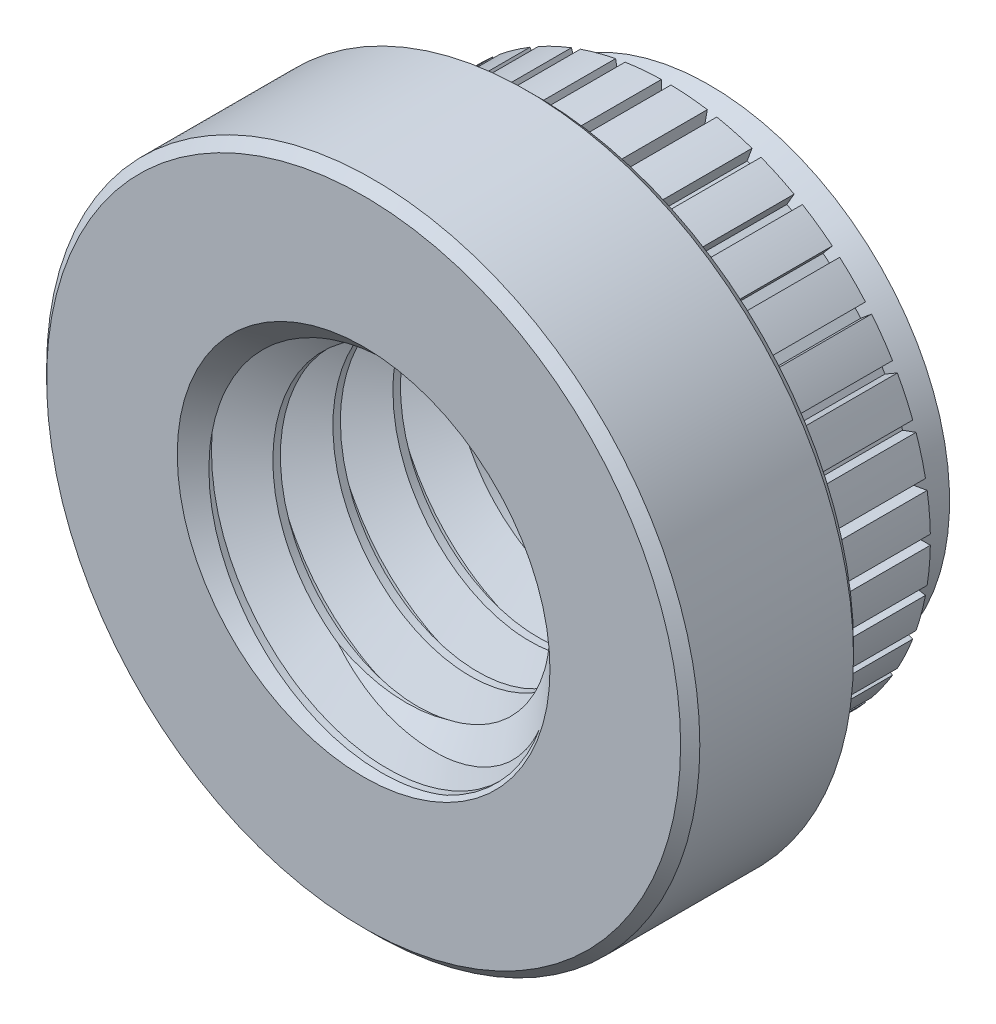
from build123d import *

# Parameters (mm, degrees)
SKETCH1_R               = 4.318
EXTRUDE1_DEPTH          = 2.286
SKETCH2_R               = 3.4925
EXTRUDE2_DEPTH          = 2.286
SKETCH3_W               = 0.127
SKETCH3_H               = 1.016
CUT_EXTRUDE_THIN1_DEPTH = 2.286
CIRPATTERN1_COUNT       = 36
SKETCH5_OUTSIDE_W       = 13.66
SKETCH5_OUTSIDE_H       = 13.66
SKETCH5_OUTSIDE_R       = 3.175
CUT_EXTRUDE1_DEPTH      = 0.5715
CUT_EXTRUDE1_DRAFT      = 20
CHAMFER2_SIZE           = 0.127
SKETCH7_R               = 2.413
CUT_EXTRUDE3_DEPTH      = 8.628461968
SWEEP1_PITCH            = 0.79375
SKETCH10_R              = 4.318
CUT_EXTRUDE4_DEPTH      = 9.064020391
SKETCH11_R              = 3.175
CUT_EXTRUDE5_DEPTH      = 8.628462028


with BuildPart() as part:
    # Sketch1 → Extrude1 (new body)
    with BuildSketch(Plane.XY):
        Circle(SKETCH1_R)
    extrude(amount=-EXTRUDE1_DEPTH)

    # Sketch2 → Extrude2 (add)
    with BuildSketch(Plane(origin=(0, 0, -2.286), x_dir=(-1, 0, 0), z_dir=(0, 0, -1))):
        with Locations(Location((0, 0, 0), (0, 0, 180))):
            Circle(SKETCH2_R)
    extrude(amount=EXTRUDE2_DEPTH)

    # Sketch3 → Cut-Extrude-Thin1 (cut)
    with BuildSketch(Plane(origin=(0, 0, -4.572), x_dir=(-1, 0, 0), z_dir=(0, 0, -1))):
        with Locations((0, 3.81)):
            Rectangle(SKETCH3_W, SKETCH3_H)
    cut_extrude_thin1 = extrude(amount=-CUT_EXTRUDE_THIN1_DEPTH, mode=Mode.SUBTRACT)

    # CirPattern1: Cut-Extrude-Thin1 ×36 about axis
    cirpattern1_axis = Axis((0, 0, 0), (0, 0, 1))
    for i in range(1, CIRPATTERN1_COUNT):
        add(cut_extrude_thin1.rotate(cirpattern1_axis, i * 360 / CIRPATTERN1_COUNT), mode=Mode.SUBTRACT)


with BuildPart() as cut_extrude1_tool:
    # Sketch5 outside → Cut-Extrude1 (with draft: the straight prism first)
    with BuildSketch(Plane(origin=(0, 0, -4.572), x_dir=(-1, 0, 0), z_dir=(0, 0, -1))):
        Rectangle(SKETCH5_OUTSIDE_W, SKETCH5_OUTSIDE_H)
        Circle(SKETCH5_OUTSIDE_R, mode=Mode.SUBTRACT)
    extrude(amount=-CUT_EXTRUDE1_DEPTH)
    # Cut-Extrude1: the draft: its side faces are tilted about the plane it starts from
    cut_extrude1_sides = [cut_extrude1_tool.faces().sort_by_distance(p)[0] for p in [
        (0, -6.83, -4.28625),
        (-6.83, 0, -4.28625),
        (0, 6.83, -4.28625),
        (6.83, 0, -4.28625),
        (3.175, 0, -4.28625),
    ]]
    draft(cut_extrude1_sides, Plane(origin=(0, 0, -4.572), x_dir=(-1, 0, 0), z_dir=(0, 0, -1)), CUT_EXTRUDE1_DRAFT)


with BuildPart() as part_1:
    add(part.part)

    # Cut-Extrude1: cut by cut_extrude1_tool
    add(cut_extrude1_tool.part, mode=Mode.SUBTRACT)

    # Chamfer2
    chamfer2_edges = [part_1.edges().sort_by_distance(p)[0] for p in [
        (-4.318, 0, 0),
        (-4.318, 0, -2.286),
    ]]
    chamfer(chamfer2_edges, length=CHAMFER2_SIZE)

    # Sketch7 → Cut-Extrude3 (cut, through all)
    with BuildSketch(Plane.XY):
        Circle(SKETCH7_R)
    extrude(amount=-CUT_EXTRUDE3_DEPTH, mode=Mode.SUBTRACT)

    # Sweep1: the profile of Sketch9 profile screwed along a right-hand helix of 9.76 turns, 6 arcs to a turn; built about Z, then put on its axis
    sweep1_z = Axis((0, 0, 0), (0, 0, 1))
    sweep1_corners = [(2.4133, 0, -0.694704455), (1.897444252, 0, -0.396875), (1.897444252, 0, -0.29765625), (2.4133, 0, 0.000173205)]
    with BuildLine(mode=Mode.PRIVATE) as sweep1_profile:
        Line(sweep1_corners[0], sweep1_corners[1])
        Line(sweep1_corners[1], sweep1_corners[2])
        Line(sweep1_corners[2], sweep1_corners[3])
        Line(sweep1_corners[3], sweep1_corners[0])
    sweep1_cap = Face(sweep1_profile.wire())
    sweep1_turn_angles = [0, 30, 60, 90, 120, 150, 180, 210, 240, 270, 300, 330, 360]
    sweep1_turn_weights = [1, 0.8660254037844387, 1, 0.8660254037844387, 1, 0.8660254037844387, 1, 0.8660254037844387, 1, 0.8660254037844387, 1, 0.8660254037844387, 1]
    sweep1_turn_rails = [Edge.make_bspline([Vector(p[0], p[1], 0).rotate(sweep1_z, sweep1_turn_angles[k]) / sweep1_turn_weights[k] + Vector(0, 0, p[2] + SWEEP1_PITCH * sweep1_turn_angles[k] / 360) for k in range(13)], [0, 0, 0, 1, 1, 2, 2, 3, 3, 4, 4, 5, 5, 6, 6, 6], 2, sweep1_turn_weights) for p in sweep1_corners]
    sweep1_turn_sides = [Face.make_surface_from_curves(sweep1_turn_rails[p[0]], sweep1_turn_rails[p[1]]) for p in [(0, 1), (1, 2), (2, 3), (3, 0)]]
    sweep1_last_angles = [3240, 3270, 3300, 3330, 3360, 3390, 3420, 3450, 3480, 3496.8, 3513.6]
    sweep1_last_weights = [1, 0.8660254037844387, 1, 0.8660254037844387, 1, 0.8660254037844387, 1, 0.8660254037844387, 1, 0.9573194975320721, 1]
    sweep1_last_rails = [Edge.make_bspline([Vector(p[0], p[1], 0).rotate(sweep1_z, sweep1_last_angles[k]) / sweep1_last_weights[k] + Vector(0, 0, p[2] + SWEEP1_PITCH * sweep1_last_angles[k] / 360) for k in range(11)], [0, 0, 0, 1, 1, 2, 2, 3, 3, 4, 4, 5, 5, 5], 2, sweep1_last_weights) for p in sweep1_corners]
    sweep1_last_sides = [Face.make_surface_from_curves(sweep1_last_rails[p[0]], sweep1_last_rails[p[1]]) for p in [(0, 1), (1, 2), (2, 3), (3, 0)]]
    sweep1 = Plane(origin=(0, 0, -4.572), x_dir=(0, 1, 0), z_dir=(0, 0, 1)) * Solid(Shell([*[p.moved(Location((0, 0, SWEEP1_PITCH * i))) for i in range(9) for p in sweep1_turn_sides], *sweep1_last_sides, sweep1_cap, sweep1_cap.rotate(sweep1_z, 3513.6).moved(Location((0, 0, SWEEP1_PITCH * 3513.6 / 360)))]))
    add(sweep1)

    # Sketch10 → Cut-Extrude4 (cut, through all)
    with BuildSketch(Plane.XY):
        Circle(SKETCH10_R)
    extrude(amount=CUT_EXTRUDE4_DEPTH, mode=Mode.SUBTRACT)

    # Sketch11 → Cut-Extrude5 (cut, through all)
    with BuildSketch(Plane(origin=(0, 0, -4.572), x_dir=(-1, 0, 0), z_dir=(0, 0, -1))):
        Circle(SKETCH11_R)
    extrude(amount=CUT_EXTRUDE5_DEPTH, mode=Mode.SUBTRACT)

    # Cut-Extrude6 cone 1 section (through the dimple's axis) → Cut-Extrude6 (revolve, cut)
    with BuildSketch(Plane(origin=(0, 0, 0), x_dir=(0, -1, 0), z_dir=(1, 0, 0))):
        Polygon((0, 0), (2.4638, 0), (0, 2.4638), align=None)
    revolve(axis=Axis((0, 0, 0), (0, 0, -1)), mode=Mode.SUBTRACT)

    # Cut-Extrude7 cone 1 section (through the dimple's axis) → Cut-Extrude7 (revolve, cut)
    with BuildSketch(Plane(origin=(0, 0, -4.572), x_dir=(0, 1, 0), z_dir=(1, 0, 0))):
        Polygon((0, 0), (2.4638, 0), (0, 2.4638), align=None)
    revolve(axis=Axis((0, 0, -4.572), (0, 0, 1)), mode=Mode.SUBTRACT)


solid = part_1.part
